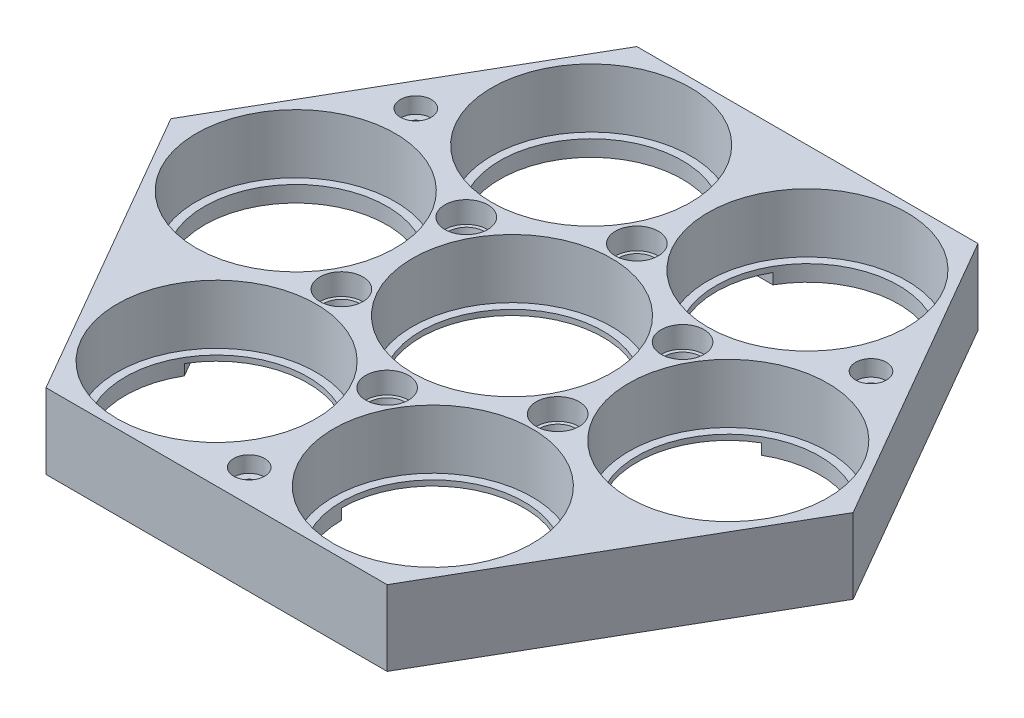
from build123d import *

# Parameters (mm, degrees)
SKETCH1_R                    = 17
BOSS_EXTRUDE1_DEPTH          = 1
SKETCH2_R                    = 18.525
BOSS_EXTRUDE2_DEPTH          = 11
CUT_EXTRUDE1_DEPTH           = 85.943417218
CUT_EXTRUDE1_DEPTH_BACK      = 4
SKETCH3_R                    = 4
SKETCH3_2_R                  = 4
CUT_EXTRUDE2_DEPTH           = 85.943417218
CUT_EXTRUDE2_DRAFT           = -9
CUT_EXTRUDE2_PROFILE_2_DEPTH = 85.943417218
CUT_EXTRUDE2_PROFILE_2_DRAFT = -9
CUT_EXTRUDE2_PROFILE_3_DEPTH = 85.943417218
CUT_EXTRUDE2_PROFILE_3_DRAFT = -9
CUT_EXTRUDE2_PROFILE_4_DEPTH = 85.943417218
CUT_EXTRUDE2_PROFILE_4_DRAFT = -9
CUT_EXTRUDE2_PROFILE_5_DEPTH = 85.943417218
CUT_EXTRUDE2_PROFILE_5_DRAFT = -9
CUT_EXTRUDE2_PROFILE_6_DEPTH = 85.943417218
CUT_EXTRUDE2_PROFILE_6_DRAFT = -9
BOSS_EXTRUDE3_START          = 2
BOSS_EXTRUDE3_DEPTH          = 2
SKETCH7_R                    = 1.55
CUT_EXTRUDE4_DEPTH           = 86.248953828
SKETCH7_3_R                  = 2.875
SKETCH7_3_R_2                = 1.55
CUT_EXTRUDE5_DEPTH           = 3


with BuildPart() as part:
    # Sketch1 → Boss-Extrude1 (new body)
    with BuildSketch(Plane(origin=(0, 0, 0), x_dir=(1, 0, 0), z_dir=(0, 1, 0))):
        Polygon((31.783607924, -55.050823773), (63.567215848, 0), (31.783607924, 55.050823773), (-31.783607924, 55.050823773), (-63.567215848, 0), (-31.783607924, -55.050823773), align=None)
        with Locations((-20.15, -34.900823773)):
            Circle(SKETCH1_R, mode=Mode.SUBTRACT)
        with Locations((20.15, -34.900823773)):
            Circle(SKETCH1_R, mode=Mode.SUBTRACT)
        with Locations((-40.3, 0)):
            Circle(SKETCH1_R, mode=Mode.SUBTRACT)
        with BuildLine():
            ThreePointArc((-17, 0), (0, 17), (17, 0))
            ThreePointArc((17, 0), (0, -17), (-17, 0))
        make_face(mode=Mode.SUBTRACT)
        with Locations((-20.15, 34.900823773)):
            Circle(SKETCH1_R, mode=Mode.SUBTRACT)
        with Locations((40.3, 0)):
            Circle(SKETCH1_R, mode=Mode.SUBTRACT)
        with Locations((20.15, 34.900823773)):
            Circle(SKETCH1_R, mode=Mode.SUBTRACT)
    extrude(amount=BOSS_EXTRUDE1_DEPTH)

    # Sketch2 → Boss-Extrude2 (add)
    with BuildSketch(Plane(origin=(0, 1, 0), x_dir=(1, 0, 0), z_dir=(0, 1, 0))):
        Polygon((63.567215848, 0), (31.783607924, 55.050823773), (-31.783607924, 55.050823773), (-63.567215848, 0), (-31.783607924, -55.050823773), (31.783607924, -55.050823773), align=None)
        with Locations((-40.3, 0)):
            Circle(SKETCH2_R, mode=Mode.SUBTRACT)
        with Locations((-20.15, 34.900823773)):
            Circle(SKETCH2_R, mode=Mode.SUBTRACT)
        with Locations((20.15, 34.900823773)):
            Circle(SKETCH2_R, mode=Mode.SUBTRACT)
        Circle(SKETCH2_R, mode=Mode.SUBTRACT)
        with Locations((40.3, 0)):
            Circle(SKETCH2_R, mode=Mode.SUBTRACT)
        with Locations((20.15, -34.900823773)):
            Circle(SKETCH2_R, mode=Mode.SUBTRACT)
        with Locations((-20.15, -34.900823773)):
            Circle(SKETCH2_R, mode=Mode.SUBTRACT)
    extrude(amount=BOSS_EXTRUDE2_DEPTH)

    # Sketch3 → Cut-Extrude1 (cut, two sides: drawn at the far end of the back side and taken through both)
    with BuildSketch(Plane(origin=(0, 12, 0), x_dir=(1, 0, 0), z_dir=(0, 1, 0)).offset(-CUT_EXTRUDE1_DEPTH_BACK)):
        with Locations((-20.15, 11.633607924)):
            Circle(SKETCH3_R)
        with Locations((20.15, 11.633607924)):
            Circle(SKETCH3_R)
        with Locations((0, -23.267215848)):
            Circle(SKETCH3_R)
        with Locations((-20.15, -11.633607924)):
            Circle(SKETCH3_R)
        with Locations((20.15, -11.633607924)):
            Circle(SKETCH3_R)
        with Locations((0, 23.267215848)):
            Circle(SKETCH3_R)
    extrude(amount=CUT_EXTRUDE1_DEPTH + CUT_EXTRUDE1_DEPTH_BACK, mode=Mode.SUBTRACT)


with BuildPart() as cut_extrude2_tool:
    # Sketch3<2> → Cut-Extrude2 (with draft: the straight prism first)
    with BuildSketch(Plane(origin=(0, 12, 0), x_dir=(1, 0, 0), z_dir=(0, 1, 0))):
        with Locations((-20.15, 11.633607924)):
            Circle(SKETCH3_2_R)
    extrude(amount=-CUT_EXTRUDE2_DEPTH)
    # Cut-Extrude2: the draft: its side faces are tilted about the plane it starts from
    cut_extrude2_sides = [cut_extrude2_tool.faces().sort_by_distance(p)[0] for p in [
        (-24.15, -30.971708609, -11.633607924),
    ]]
    draft(cut_extrude2_sides, Plane(origin=(0, 12, 0), x_dir=(1, 0, 0), z_dir=(0, 1, 0)), CUT_EXTRUDE2_DRAFT)


with BuildPart() as part_1:
    add(part.part)

    # Cut-Extrude2: cut by cut_extrude2_tool
    add(cut_extrude2_tool.part, mode=Mode.SUBTRACT)


with BuildPart() as cut_extrude2_profile_2_tool:
    # Sketch3<2> → Cut-Extrude2 profile 2 (with draft: the straight prism first)
    with BuildSketch(Plane(origin=(0, 12, 0), x_dir=(1, 0, 0), z_dir=(0, 1, 0))):
        with Locations((20.15, 11.633607924)):
            Circle(SKETCH3_2_R)
    extrude(amount=-CUT_EXTRUDE2_PROFILE_2_DEPTH)
    # Cut-Extrude2 profile 2: the draft: its side faces are tilted about the plane it starts from
    cut_extrude2_profile_2_sides = [cut_extrude2_profile_2_tool.faces().sort_by_distance(p)[0] for p in [
        (16.15, -30.971708609, -11.633607924),
    ]]
    draft(cut_extrude2_profile_2_sides, Plane(origin=(0, 12, 0), x_dir=(1, 0, 0), z_dir=(0, 1, 0)), CUT_EXTRUDE2_PROFILE_2_DRAFT)


with BuildPart() as part_2:
    add(part_1.part)

    # Cut-Extrude2 profile 2: cut by cut_extrude2_profile_2_tool
    add(cut_extrude2_profile_2_tool.part, mode=Mode.SUBTRACT)


with BuildPart() as cut_extrude2_profile_3_tool:
    # Sketch3<2> → Cut-Extrude2 profile 3 (with draft: the straight prism first)
    with BuildSketch(Plane(origin=(0, 12, 0), x_dir=(1, 0, 0), z_dir=(0, 1, 0))):
        with Locations((0, -23.267215848)):
            Circle(SKETCH3_2_R)
    extrude(amount=-CUT_EXTRUDE2_PROFILE_3_DEPTH)
    # Cut-Extrude2 profile 3: the draft: its side faces are tilted about the plane it starts from
    cut_extrude2_profile_3_sides = [cut_extrude2_profile_3_tool.faces().sort_by_distance(p)[0] for p in [
        (-4, -30.971708609, 23.267215848),
    ]]
    draft(cut_extrude2_profile_3_sides, Plane(origin=(0, 12, 0), x_dir=(1, 0, 0), z_dir=(0, 1, 0)), CUT_EXTRUDE2_PROFILE_3_DRAFT)


with BuildPart() as part_3:
    add(part_2.part)

    # Cut-Extrude2 profile 3: cut by cut_extrude2_profile_3_tool
    add(cut_extrude2_profile_3_tool.part, mode=Mode.SUBTRACT)


with BuildPart() as cut_extrude2_profile_4_tool:
    # Sketch3<2> → Cut-Extrude2 profile 4 (with draft: the straight prism first)
    with BuildSketch(Plane(origin=(0, 12, 0), x_dir=(1, 0, 0), z_dir=(0, 1, 0))):
        with Locations((-20.15, -11.633607924)):
            Circle(SKETCH3_2_R)
    extrude(amount=-CUT_EXTRUDE2_PROFILE_4_DEPTH)
    # Cut-Extrude2 profile 4: the draft: its side faces are tilted about the plane it starts from
    cut_extrude2_profile_4_sides = [cut_extrude2_profile_4_tool.faces().sort_by_distance(p)[0] for p in [
        (-24.15, -30.971708609, 11.633607924),
    ]]
    draft(cut_extrude2_profile_4_sides, Plane(origin=(0, 12, 0), x_dir=(1, 0, 0), z_dir=(0, 1, 0)), CUT_EXTRUDE2_PROFILE_4_DRAFT)


with BuildPart() as part_4:
    add(part_3.part)

    # Cut-Extrude2 profile 4: cut by cut_extrude2_profile_4_tool
    add(cut_extrude2_profile_4_tool.part, mode=Mode.SUBTRACT)


with BuildPart() as cut_extrude2_profile_5_tool:
    # Sketch3<2> → Cut-Extrude2 profile 5 (with draft: the straight prism first)
    with BuildSketch(Plane(origin=(0, 12, 0), x_dir=(1, 0, 0), z_dir=(0, 1, 0))):
        with Locations((20.15, -11.633607924)):
            Circle(SKETCH3_2_R)
    extrude(amount=-CUT_EXTRUDE2_PROFILE_5_DEPTH)
    # Cut-Extrude2 profile 5: the draft: its side faces are tilted about the plane it starts from
    cut_extrude2_profile_5_sides = [cut_extrude2_profile_5_tool.faces().sort_by_distance(p)[0] for p in [
        (16.15, -30.971708609, 11.633607924),
    ]]
    draft(cut_extrude2_profile_5_sides, Plane(origin=(0, 12, 0), x_dir=(1, 0, 0), z_dir=(0, 1, 0)), CUT_EXTRUDE2_PROFILE_5_DRAFT)


with BuildPart() as part_5:
    add(part_4.part)

    # Cut-Extrude2 profile 5: cut by cut_extrude2_profile_5_tool
    add(cut_extrude2_profile_5_tool.part, mode=Mode.SUBTRACT)


with BuildPart() as cut_extrude2_profile_6_tool:
    # Sketch3<2> → Cut-Extrude2 profile 6 (with draft: the straight prism first)
    with BuildSketch(Plane(origin=(0, 12, 0), x_dir=(1, 0, 0), z_dir=(0, 1, 0))):
        with Locations((0, 23.267215848)):
            Circle(SKETCH3_2_R)
    extrude(amount=-CUT_EXTRUDE2_PROFILE_6_DEPTH)
    # Cut-Extrude2 profile 6: the draft: its side faces are tilted about the plane it starts from
    cut_extrude2_profile_6_sides = [cut_extrude2_profile_6_tool.faces().sort_by_distance(p)[0] for p in [
        (-4, -30.971708609, -23.267215848),
    ]]
    draft(cut_extrude2_profile_6_sides, Plane(origin=(0, 12, 0), x_dir=(1, 0, 0), z_dir=(0, 1, 0)), CUT_EXTRUDE2_PROFILE_6_DRAFT)


with BuildPart() as part_6:
    add(part_5.part)

    # Cut-Extrude2 profile 6: cut by cut_extrude2_profile_6_tool
    add(cut_extrude2_profile_6_tool.part, mode=Mode.SUBTRACT)

    # Sketch5 → Boss-Extrude3 (add)
    with BuildSketch(Plane.XZ.offset(BOSS_EXTRUDE3_START)):
        Polygon((-31.783607924, -55.050823773), (31.783607924, -55.050823773), (63.567215848, 0), (31.783607924, 55.050823773), (-31.783607924, 55.050823773), (-63.567215848, 0), align=None)
        with BuildLine():
            ThreePointArc((-31.8, -14.722431864), (-56.740483978, -4.325561993), (-40.146124932, 16.999303588))
            Line((-40.146124932, 16.999303588), (-34.794891219, 26.267912261))
            ThreePointArc((-34.794891219, 26.267912261), (-24.624195418, 51.301481545), (-3.15, 34.900823773))
            Line((-3.15, 34.900823773), (3.15, 34.900823773))
            ThreePointArc((3.15, 34.900823773), (24.624195418, 51.301481545), (34.794891219, 26.267912261))
            Line((34.794891219, 26.267912261), (40.146124932, 16.999303588))
            ThreePointArc((40.146124932, 16.999303588), (56.740483978, -4.325561993), (31.8, -14.722431864))
            Line((31.8, -14.722431864), (28.65, -20.178391908))
            ThreePointArc((28.65, -20.178391908), (32.116288561, -46.975919552), (5.351233712, -43.267215848))
            Line((5.351233712, -43.267215848), (-5.351233712, -43.267215848))
            ThreePointArc((-5.351233712, -43.267215848), (-32.116288561, -46.975919552), (-28.65, -20.178391908))
            Line((-28.65, -20.178391908), (-31.8, -14.722431864))
        make_face(mode=Mode.SUBTRACT)
    extrude(amount=-BOSS_EXTRUDE3_DEPTH)

    # Sketch7 → Cut-Extrude4 (cut, through all)
    with BuildSketch(Plane(origin=(0, 12, 0), x_dir=(1, 0, 0), z_dir=(0, 1, 0))):
        with Locations((-42.409454211, 24.485109805)):
            Circle(SKETCH7_R)
        with Locations((42.409454211, 24.485109805)):
            Circle(SKETCH7_R)
        with Locations((0, -48.97021961)):
            Circle(SKETCH7_R)
    extrude(amount=-CUT_EXTRUDE4_DEPTH, mode=Mode.SUBTRACT)

    # Sketch7<3> → Cut-Extrude5 (cut)
    # profile 1 of 3: a face of its own
    with BuildSketch(Plane(origin=(0, 12, 0), x_dir=(1, 0, 0), z_dir=(0, 1, 0))):
        with Locations((-42.409454211, 24.485109805)):
            Circle(SKETCH7_3_R)
        with Locations((-42.409454211, 24.485109805)):
            Circle(SKETCH7_3_R_2, mode=Mode.SUBTRACT)
    # profile 2 of 3: a face of its own
    with BuildSketch(Plane(origin=(0, 12, 0), x_dir=(1, 0, 0), z_dir=(0, 1, 0))):
        with Locations((42.409454211, 24.485109805)):
            Circle(SKETCH7_3_R)
    # profile 3 of 3: a face of its own
    with BuildSketch(Plane(origin=(0, 12, 0), x_dir=(1, 0, 0), z_dir=(0, 1, 0))):
        with Locations((0, -48.97021961)):
            Circle(SKETCH7_3_R)
    extrude(amount=-CUT_EXTRUDE5_DEPTH, mode=Mode.SUBTRACT)


solid = part_6.part
